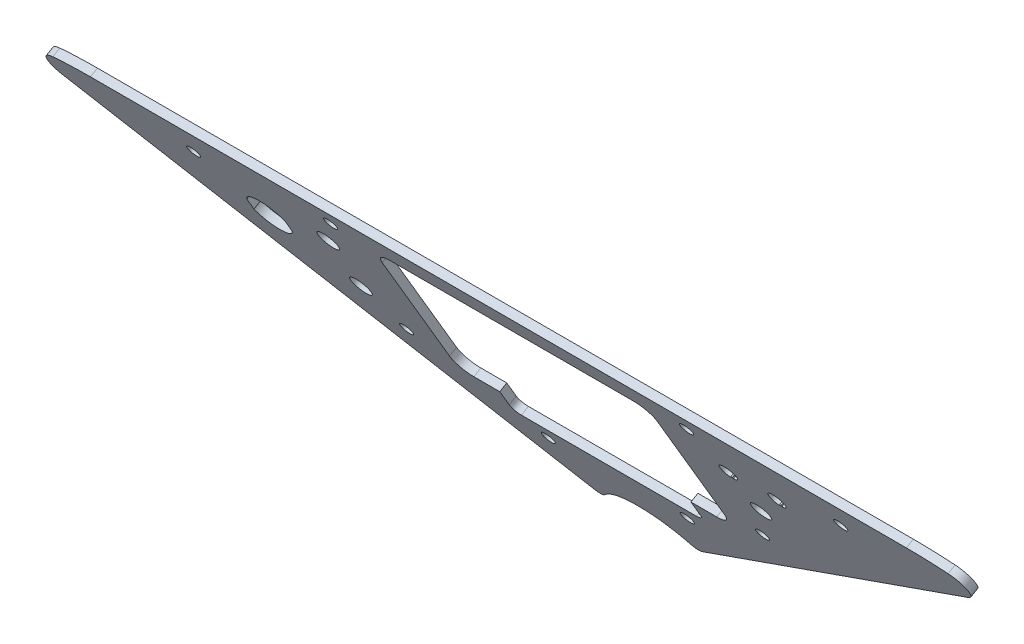
from build123d import *

# Parameters (mm, degrees)
SKETCH2_R           = 2.4892
BOSS_EXTRUDE1_DEPTH = 3.175
SKETCH4_R           = 2.4892
CUT_EXTRUDE1_DEPTH  = 919.047972743
SKETCH6_R           = 4
CUT_EXTRUDE3_DEPTH  = 919.045301638
CUT_EXTRUDE2_DEPTH  = 919.047972743
SKETCH7_R           = 3.75
CUT_EXTRUDE4_DEPTH  = 919.047972743
CUT_EXTRUDE5_DEPTH  = 919.047972743


with BuildPart() as part:
    # Sketch2 → Boss-Extrude1 (new body)
    with BuildSketch(Plane(origin=(0, -119.026177706, 202.518411263), x_dir=(-1, 0, 0), z_dir=(-7.267823095607155e-15, 0.506696551391541, -0.8621244717602671))):
        with BuildLine():
            Line((21.054229278, 782.405033139), (177.875467972, 885.559604741))
            ThreePointArc((177.875467972, 885.559604741), (180.62401835, 892.051058523), (175.684594577, 897.080531077))
            ThreePointArc((175.684594577, 897.080531077), (167.933410831, 898.287628232), (160.099198372, 898.691420443))
            Line((160.099198372, 898.691420443), (-160.099198372, 898.691420443))
            ThreePointArc((-160.099198372, 898.691420443), (-167.933410831, 898.287628232), (-175.684594577, 897.080531077))
            ThreePointArc((-175.684594577, 897.080531077), (-180.62401835, 892.051058523), (-177.875467972, 885.559604741))
            Line((-177.875467972, 885.559604741), (-21.054229278, 782.405033139))
            ThreePointArc((-21.054229278, 782.405033139), (-18.86350312, 781.91408365), (-16.895725938, 782.994900685))
            ThreePointArc((-16.895725938, 782.994900685), (0, 790.780888599), (16.895725938, 782.994900685))
            ThreePointArc((16.895725938, 782.994900685), (18.86350312, 781.91408365), (21.054229278, 782.405033139))
        make_face()
        with Locations((-127, 884.16502092)):
            Circle(SKETCH2_R, mode=Mode.SUBTRACT)
        with Locations((-27.242242795, 806.191391474)):
            Circle(SKETCH2_R, mode=Mode.SUBTRACT)
        with Locations((27.242242795, 806.191391474)):
            Circle(SKETCH2_R, mode=Mode.SUBTRACT)
        with Locations((127, 884.16502092)):
            Circle(SKETCH2_R, mode=Mode.SUBTRACT)
    extrude(amount=BOSS_EXTRUDE1_DEPTH)

    # Sketch4 → Cut-Extrude1 (cut, through all)
    with BuildSketch(Plane(origin=(0, -117.417416155, 199.781166065), x_dir=(-1, 0, 0), z_dir=(-7.267823095607155e-15, 0.506696551391541, -0.8621244717602671))):
        with Locations((-69.85, 890.753920443)):
            Circle(SKETCH4_R)
        with Locations((-69.85, 832.016420443)):
            Circle(SKETCH4_R)
        with Locations((69.85, 832.016420443)):
            Circle(SKETCH4_R)
        with Locations((69.85, 890.753920443)):
            Circle(SKETCH4_R)
    extrude(amount=-CUT_EXTRUDE1_DEPTH, mode=Mode.SUBTRACT)

    # Sketch6 → Cut-Extrude3 (cut, through all)
    with BuildSketch(Plane(origin=(0, -119.026177706, 202.518411263), x_dir=(1, 0, 0), z_dir=(7.267823095607155e-15, -0.506696551391541, 0.8621244717602671))):
        with Locations((-79.654, 873.291420443)):
            Circle(SKETCH6_R)
        with Locations((-79.654, 847.891420443)):
            Circle(SKETCH6_R)
    extrude(amount=-CUT_EXTRUDE3_DEPTH, mode=Mode.SUBTRACT)

    # Sketch5 → Cut-Extrude2 (cut, through all)
    with BuildSketch(Plane(origin=(0, -117.417416155, 199.781166065), x_dir=(-1, 0, 0), z_dir=(-7.267823095607155e-15, 0.506696551391541, -0.8621244717602671))):
        with BuildLine():
            Line((99.215659501, 862.570038261), (99.215659501, 868.137802624))
            ThreePointArc((99.215659501, 868.137802624), (106.715659501, 873.353920443), (114.215659501, 868.137802624))
            Line((114.215659501, 868.137802624), (114.215659501, 862.570038261))
            ThreePointArc((114.215659501, 862.570038261), (106.715659501, 857.353920443), (99.215659501, 862.570038261))
        make_face()
    extrude(amount=-CUT_EXTRUDE2_DEPTH, mode=Mode.SUBTRACT)

    # Sketch7 → Cut-Extrude4 (cut, through all)
    with BuildSketch(Plane(origin=(0, -117.417416155, 199.781166065), x_dir=(-1, 0, 0), z_dir=(-7.267823095607155e-15, 0.506696551391541, -0.8621244717602671))):
        with Locations((-80.15, 853.447670443)):
            Circle(SKETCH7_R)
        with BuildLine():
            Line((-77.2798, 869.260789475), (-77.2798, 869.957670443))
            Line((-77.2798, 869.957670443), (-76.6702, 869.957670443))
            Line((-76.6702, 869.957670443), (-76.6702, 869.260789475))
            ThreePointArc((-76.6702, 869.260789475), (-76.975, 875.748870443), (-77.2798, 869.260789475))
        make_face()
        with BuildLine():
            Line((-96.3298, 869.260789475), (-96.3298, 869.957670443))
            Line((-96.3298, 869.957670443), (-95.7202, 869.957670443))
            Line((-95.7202, 869.957670443), (-95.7202, 869.260789475))
            ThreePointArc((-95.7202, 869.260789475), (-96.025, 875.748870443), (-96.3298, 869.260789475))
        make_face()
    extrude(amount=-CUT_EXTRUDE4_DEPTH, mode=Mode.SUBTRACT)

    # Sketch8 → Cut-Extrude5 (cut, through all)
    with BuildSketch(Plane(origin=(0, -117.417416155, 199.781166065), x_dir=(-1, 0, 0), z_dir=(-7.267823095607155e-15, 0.506696551391541, -0.8621244717602671))):
        with BuildLine():
            Line((47.65, 888.428920443), (-47.65, 888.428920443))
            ThreePointArc((-47.65, 888.428920443), (-52.140128061, 886.569048503), (-54, 882.078920443))
            Line((-54, 882.078920443), (-54, 829.978920443))
            ThreePointArc((-54, 829.978920443), (-52.140128061, 825.488792382), (-47.65, 823.628920443))
            Line((-47.65, 823.628920443), (-37.5, 823.628920443))
            Line((-37.5, 823.628920443), (-37.5, 816.287420443))
            ThreePointArc((-37.5, 816.287420443), (-36.57006403, 814.042356413), (-34.325, 813.112420443))
            Line((-34.325, 813.112420443), (34.325, 813.112420443))
            ThreePointArc((34.325, 813.112420443), (36.57006403, 814.042356413), (37.5, 816.287420443))
            Line((37.5, 816.287420443), (37.5, 823.628920443))
            Line((37.5, 823.628920443), (47.65, 823.628920443))
            ThreePointArc((47.65, 823.628920443), (52.140128061, 825.488792382), (54, 829.978920443))
            Line((54, 829.978920443), (54, 882.078920443))
            ThreePointArc((54, 882.078920443), (52.140128061, 886.569048503), (47.65, 888.428920443))
        make_face()
    extrude(amount=-CUT_EXTRUDE5_DEPTH, mode=Mode.SUBTRACT)


solid = part.part
